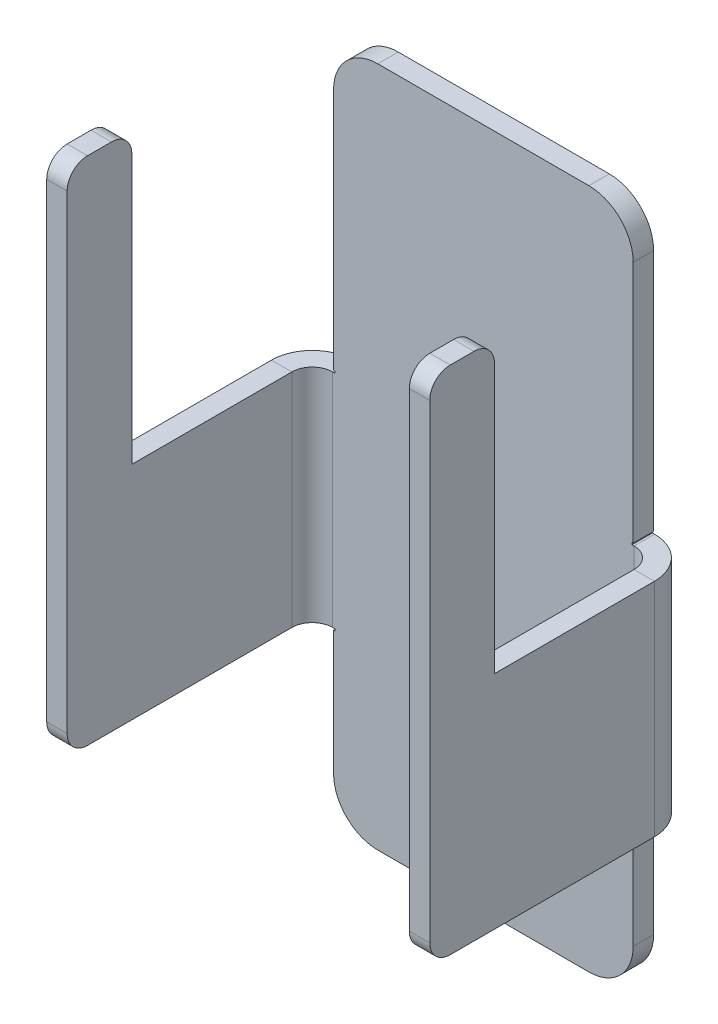
from build123d import *

# Parameters (mm, degrees)
CROQUIS1_W               = 28.575
CROQUIS1_H               = 50.8
BRIDA_BASE1_DEPTH        = 1.524
CROQUIS6_R               = 3.9751
CROQUIS6_W               = 3.1115
CROQUIS6_H               = 21.59
CROQUIS6_H_2             = 12.7
CORTAR_EXTRUIR1_DEPTH    = 30.182447331
BRIDA_START              = -12.7
BRIDA_DE_ARISTA1_DEPTH   = 16.51
BRIDA_START_2            = -12.8524
BRIDA_DE_ARISTA1_2_DEPTH = 0.1524
BRIDA_START_3            = 3.81
BRIDA_DE_ARISTA1_3_DEPTH = 0.1524
BRIDA_DE_ARISTA1_4_DEPTH = 16.51
CROQUIS13_W              = 1.524
CROQUIS13_H              = 4.826
SALIENTE_EXTRUIR1_DEPTH  = 21.59
REDONDEO1_R              = 3.302
REDONDEO2_R              = 1.524


# Read off the part's stored shape, not the designer's step: Brida de arista1
# Sheet-metal steps are written as plain solids
with BuildPart() as part:
    # Croquis1 → Brida base1 (new body)
    with BuildSketch(Plane.XY):
        Rectangle(CROQUIS1_W, CROQUIS1_H)
    extrude(amount=-BRIDA_BASE1_DEPTH)

    # Croquis6 → Cortar-Extruir1 (cut, through all)
    with BuildSketch(Plane.XY):
        with Locations((0, -12.7)):
            Circle(CROQUIS6_R)
        with Locations((-12.73175, 14.605)):
            Rectangle(CROQUIS6_W, CROQUIS6_H)
        with Locations((12.73175, 14.605)):
            Rectangle(CROQUIS6_W, CROQUIS6_H)
        with Locations((-12.73175, -19.05)):
            Rectangle(CROQUIS6_W, CROQUIS6_H_2)
        with Locations((12.73175, -19.05)):
            Rectangle(CROQUIS6_W, CROQUIS6_H_2)
    extrude(amount=-CORTAR_EXTRUIR1_DEPTH, mode=Mode.SUBTRACT)

    # Brida de arista1 outline → Brida de arista1 (cut)
    with BuildSketch(Plane(origin=(0, 0, 0), x_dir=(1, 0, 0), z_dir=(0, 1, 0)).offset(BRIDA_START)):
        with BuildLine():
            Line((14.2875, 1.524), (11.2395, 1.524))
            ThreePointArc((11.2395, 1.524), (12.7635, 1.115645431), (13.879145431, 0))
            Line((13.879145431, 0), (14.2875, 0))
            Line((14.2875, 0), (14.2875, 1.524))
        make_face()
        with BuildLine():
            ThreePointArc((-13.879145431, 0), (-12.7635, 1.115645431), (-11.2395, 1.524))
            Line((-11.2395, 1.524), (-14.2875, 1.524))
            Line((-14.2875, 1.524), (-14.2875, 0))
            Line((-14.2875, 0), (-13.879145431, 0))
        make_face()
    extrude(amount=BRIDA_DE_ARISTA1_DEPTH, mode=Mode.SUBTRACT)

    # Brida de arista1 2 outline → Brida de arista1 2 (cut)
    with BuildSketch(Plane(origin=(0, 0, 0), x_dir=(1, 0, 0), z_dir=(0, 1, 0)).offset(BRIDA_START_2)):
        with BuildLine():
            Line((11.0871, 1.524), (11.0871, 0))
            Line((11.0871, 0), (13.879145431, 0))
            ThreePointArc((13.879145431, 0), (12.7635, 1.115645431), (11.2395, 1.524))
            Line((11.2395, 1.524), (11.0871, 1.524))
        make_face()
        with BuildLine():
            Line((-13.879145431, 0), (-11.0871, 0))
            Line((-11.0871, 0), (-11.0871, 1.524))
            Line((-11.0871, 1.524), (-11.2395, 1.524))
            ThreePointArc((-11.2395, 1.524), (-12.7635, 1.115645431), (-13.879145431, 0))
        make_face()
    extrude(amount=BRIDA_DE_ARISTA1_2_DEPTH, mode=Mode.SUBTRACT)

    # Brida de arista1 3 outline → Brida de arista1 3 (cut)
    with BuildSketch(Plane(origin=(0, 0, 0), x_dir=(1, 0, 0), z_dir=(0, 1, 0)).offset(BRIDA_START_3)):
        with BuildLine():
            Line((11.0871, 1.524), (11.0871, 0))
            Line((11.0871, 0), (13.879145431, 0))
            ThreePointArc((13.879145431, 0), (12.7635, 1.115645431), (11.2395, 1.524))
            Line((11.2395, 1.524), (11.0871, 1.524))
        make_face()
        with BuildLine():
            Line((-13.879145431, 0), (-11.0871, 0))
            Line((-11.0871, 0), (-11.0871, 1.524))
            Line((-11.0871, 1.524), (-11.2395, 1.524))
            ThreePointArc((-11.2395, 1.524), (-12.7635, 1.115645431), (-13.879145431, 0))
        make_face()
    extrude(amount=BRIDA_DE_ARISTA1_3_DEPTH, mode=Mode.SUBTRACT)

    # Brida de arista1 4 outline → Brida de arista1 4 (add)
    with BuildSketch(Plane(origin=(0, 0, 0), x_dir=(1, 0, 0), z_dir=(0, 1, 0)).offset(BRIDA_START)):
        with BuildLine():
            Line((13.879145431, 0), (11.2395, 0))
            ThreePointArc((11.2395, 0), (12.317130735, -0.446369265), (12.7635, -1.524))
            Line((12.7635, -1.524), (12.7635, -18.288))
            Line((12.7635, -18.288), (14.2875, -18.288))
            Line((14.2875, -18.288), (14.2875, -1.524))
            ThreePointArc((14.2875, -1.524), (14.183641918, -0.735119551), (13.879145431, 0))
        make_face()
        with BuildLine():
            ThreePointArc((-12.7635, -1.524), (-12.317130735, -0.446369265), (-11.2395, 0))
            Line((-11.2395, 0), (-13.879145431, 0))
            ThreePointArc((-13.879145431, 0), (-14.183641918, -0.735119551), (-14.2875, -1.524))
            Line((-14.2875, -1.524), (-14.2875, -18.288))
            Line((-14.2875, -18.288), (-12.7635, -18.288))
            Line((-12.7635, -18.288), (-12.7635, -1.524))
        make_face()
    extrude(amount=BRIDA_DE_ARISTA1_4_DEPTH)

    # Croquis13 → Saliente-Extruir1 (add)
    with BuildSketch(Plane(origin=(0, 3.81, 0), x_dir=(1, 0, 0), z_dir=(0, 1, 0))):
        with Locations((13.5255, -15.875)):
            Rectangle(CROQUIS13_W, CROQUIS13_H)
    saliente_extruir1 = extrude(amount=SALIENTE_EXTRUIR1_DEPTH)

    # Simetría1: Saliente-Extruir1 across plane
    add(saliente_extruir1.mirror(Plane(origin=(0, 0, 0), x_dir=(0, 0, 1), z_dir=(1, 0, 0))))

    # Redondeo1
    redondeo1_edges = [part.edges().sort_by_distance(p)[0] for p in [
        (11.176, 25.4, -0.762),
        (-11.176, -25.4, -0.762),
        (11.176, -25.4, -0.762),
        (-11.176, 25.4, -0.762),
    ]]
    fillet(redondeo1_edges, radius=REDONDEO1_R)

    # Redondeo2
    redondeo2_edges = [part.edges().sort_by_distance(p)[0] for p in [
        (13.5255, -12.7, 18.288),
        (-13.5255, -12.7, 18.288),
        (13.5255, 25.4, 18.288),
        (13.5255, 25.4, 13.462),
        (-13.5255, 25.4, 13.462),
        (-13.5255, 25.4, 18.288),
    ]]
    fillet(redondeo2_edges, radius=REDONDEO2_R)


solid = part.part
